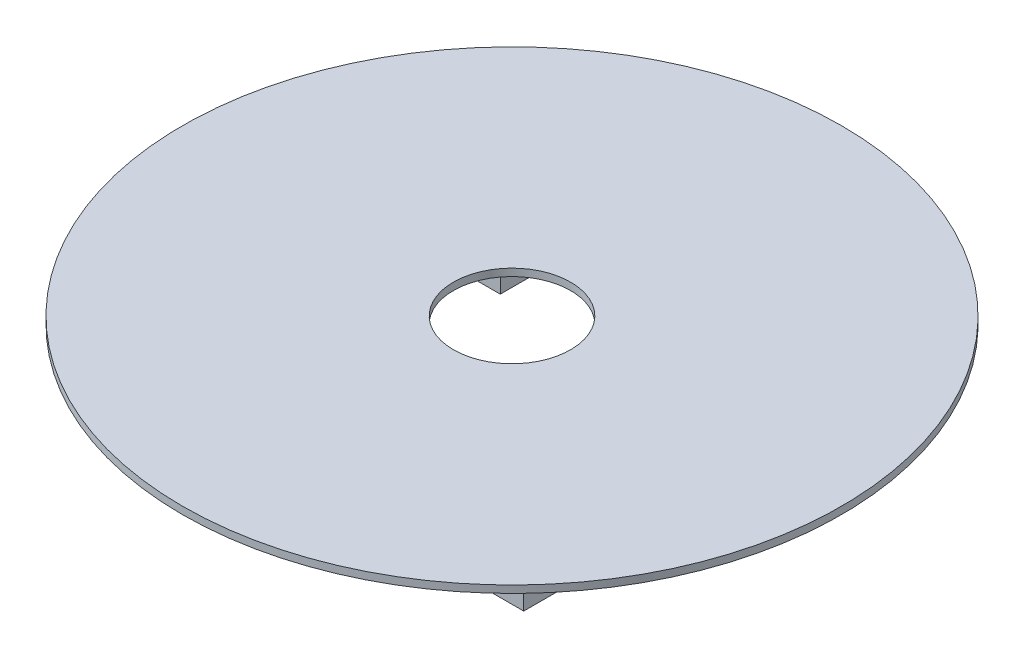
from build123d import *

# Parameters (mm, degrees)
SKETCH1_R           = 4500
SKETCH1_R_2         = 800
BOSS_EXTRUDE1_DEPTH = 100
SKETCH2_W           = 2493.452377915
SKETCH2_H           = 2493.452377915
SKETCH2_W_2         = 2173.452377915
SKETCH2_H_2         = 2173.452377915
BOSS_EXTRUDE2_DEPTH = 350


with BuildPart() as part:
    # Sketch1 → Boss-Extrude1 (new body)
    with BuildSketch(Plane(origin=(0, 0, 0), x_dir=(1, 0, 0), z_dir=(0, 1, 0))):
        Circle(SKETCH1_R)
        Circle(SKETCH1_R_2, mode=Mode.SUBTRACT)
    extrude(amount=BOSS_EXTRUDE1_DEPTH)

    # Sketch2 → Boss-Extrude2 (add)
    with BuildSketch(Plane(origin=(0, 0, 0), x_dir=(1, 0, 0), z_dir=(0, 1, 0))):
        with Locations((1873.832970144, 1873.832970144)):
            Rectangle(SKETCH2_W, SKETCH2_H)
        with Locations((-1873.832970144, 1873.832970144)):
            Rectangle(SKETCH2_W_2, SKETCH2_H)
        with Locations((-1873.832970144, -1873.832970144)):
            Rectangle(SKETCH2_W_2, SKETCH2_H_2)
        with Locations((1873.832970144, -1873.832970144)):
            Rectangle(SKETCH2_W, SKETCH2_H_2)
    extrude(amount=-BOSS_EXTRUDE2_DEPTH)


solid = part.part
